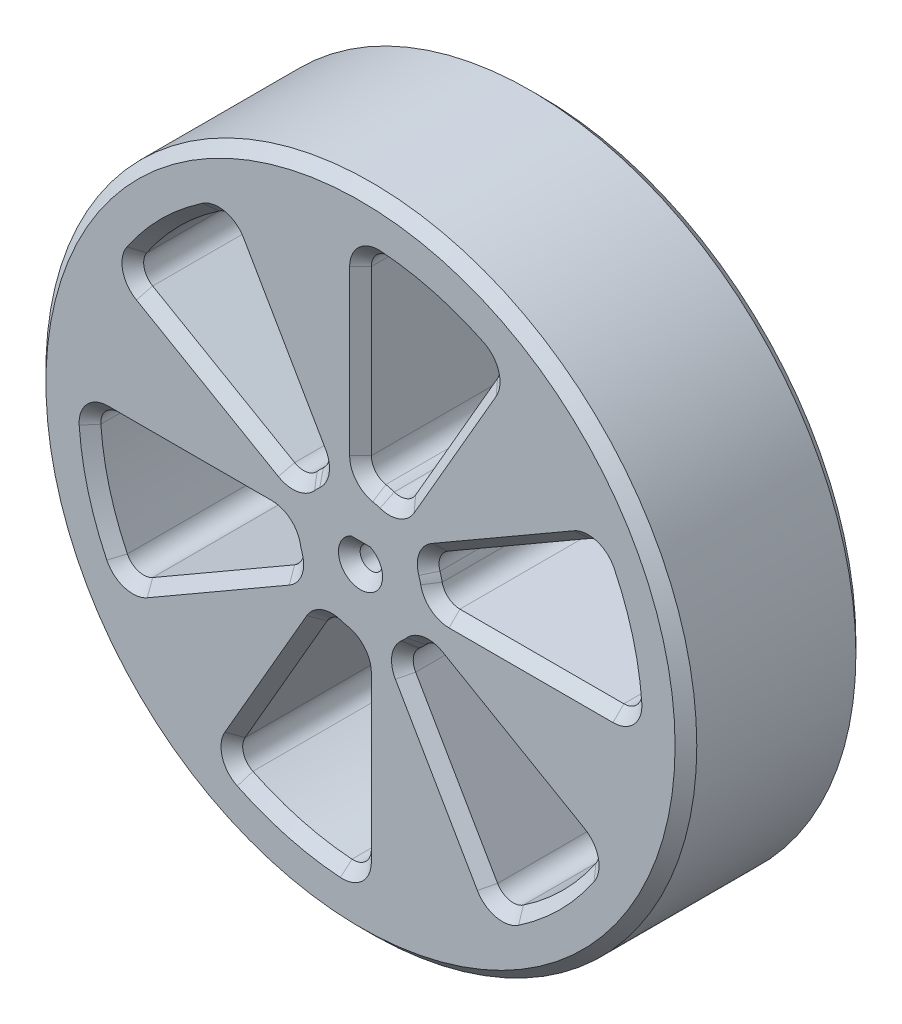
from build123d import *

# Parameters (mm, degrees)
SKETCH1_R           = 90
BOSS_EXTRUDE1_DEPTH = 50
CUT_EXTRUDE1_DEPTH  = 137.747943312
CIRPATTERN1_COUNT   = 6
FILLET1_R           = 5
CUT_EXTRUDE2_DEPTH  = 137.747943312
CHAMFER1_SIZE       = 3


with BuildPart() as part:
    # Sketch1 → Boss-Extrude1 (new body)
    with BuildSketch(Plane.XY):
        Circle(SKETCH1_R)
    extrude(amount=BOSS_EXTRUDE1_DEPTH)

    # Sketch2 → Cut-Extrude1 (cut, through all)
    with BuildSketch(Plane.XY.offset(50)):
        with BuildLine():
            Line((0, 75), (0, 20))
            ThreePointArc((0, 20), (5.176380902, 19.318516526), (10, 17.320508076))
            Line((10, 17.320508076), (37.5, 64.951905284))
            ThreePointArc((37.5, 64.951905284), (19.411428383, 72.444436972), (0, 75))
        make_face()
    cut_extrude1 = extrude(amount=-CUT_EXTRUDE1_DEPTH, mode=Mode.SUBTRACT)

    # CirPattern1: Cut-Extrude1 ×6 about axis
    cirpattern1_axis = Axis((0, 0, 50), (0, 0, -1))
    for i in range(1, CIRPATTERN1_COUNT):
        add(cut_extrude1.rotate(cirpattern1_axis, i * 360 / CIRPATTERN1_COUNT), mode=Mode.SUBTRACT)

    # Fillet1
    fillet1_edges = [part.edges().sort_by_distance(p)[0] for p in [
        (0, 75, 25),
        (37.5, 64.951905284, 25),
        (10, 17.320508076, 25),
        (-17.320508076, 10, 25),
        (-64.951905284, 37.5, 25),
        (-37.5, 64.951905284, 25),
        (-10, 17.320508076, 25),
        (0, -20, 25),
        (0, -75, 25),
        (-37.5, -64.951905284, 25),
        (-10, -17.320508076, 25),
        (-17.320508076, -10, 25),
        (-64.951905284, -37.5, 25),
        (-75, 0, 25),
        (-20, 0, 25),
        (17.320508076, -10, 25),
        (64.951905284, -37.5, 25),
        (37.5, -64.951905284, 25),
        (10, -17.320508076, 25),
        (17.320508076, 10, 25),
        (64.951905284, 37.5, 25),
        (75, 0, 25),
        (20, 0, 25),
        (0, 20, 25),
    ]]
    fillet(fillet1_edges, radius=FILLET1_R)

    # Sketch3 → Cut-Extrude2 (cut, through all)
    with BuildSketch(Plane.XY.offset(50)):
        with BuildLine():
            Line((1.833030278, 2.5), (-1.833030278, 2.5))
            ThreePointArc((-1.833030278, 2.5), (-1.401357581, -2.76517575), (3.1, 0))
            ThreePointArc((3.1, 0), (2.76517575, 1.401357581), (1.833030278, 2.5))
        make_face()
    extrude(amount=-CUT_EXTRUDE2_DEPTH, mode=Mode.SUBTRACT)

    # Chamfer1
    chamfer1_edges = [part.edges().sort_by_distance(p)[0] for p in [
        (-90, 0, 50),
        (35.360769949, 64.432798708, 50),
        (19.411428383, 72.444436972, 50),
        (1.593074281, 73.480825492, 50),
        (0, 47.158048823, 50),
        (1.127016654, 21.332619768, 50),
        (5.176380902, 19.318516526, 50),
        (9.690284831, 19.038098975, 50),
        (23.579024412, 40.840068274, 50),
        (-38.120055543, 62.839724427, 50),
        (-53.033008589, 53.033008589, 50),
        (-62.839724427, 38.120055543, 50),
        (-40.840068274, 23.579024412, 50),
        (-17.911082321, 11.642334937, 50),
        (-14.142135624, 14.142135624, 50),
        (-11.642334937, 17.911082321, 50),
        (-23.579024412, 40.840068274, 50),
        (-35.360769949, -64.432798708, 50),
        (-19.411428383, -72.444436972, 50),
        (-1.593074281, -73.480825492, 50),
        (0, -47.158048823, 50),
        (-1.127016654, -21.332619768, 50),
        (-5.176380902, -19.318516526, 50),
        (-9.690284831, -19.038098975, 50),
        (-23.579024412, -40.840068274, 50),
        (-73.480825492, -1.593074281, 50),
        (-72.444436972, -19.411428383, 50),
        (-64.432798708, -35.360769949, 50),
        (-40.840068274, -23.579024412, 50),
        (-19.038098975, -9.690284831, 50),
        (-19.318516526, -5.176380902, 50),
        (-21.332619768, -1.127016654, 50),
        (-47.158048823, 0, 50),
        (38.120055543, -62.839724427, 50),
        (53.033008589, -53.033008589, 50),
        (62.839724427, -38.120055543, 50),
        (40.840068274, -23.579024412, 50),
        (17.911082321, -11.642334937, 50),
        (14.142135624, -14.142135624, 50),
        (11.642334937, -17.911082321, 50),
        (23.579024412, -40.840068274, 50),
        (73.480825492, 1.593074281, 50),
        (72.444436972, 19.411428383, 50),
        (64.432798708, 35.360769949, 50),
        (40.840068274, 23.579024412, 50),
        (19.038098975, 9.690284831, 50),
        (19.318516526, 5.176380902, 50),
        (21.332619768, 1.127016654, 50),
        (47.158048823, 0, 50),
        (0, 2.5, 50),
        (0, -3.1, 50),
        (-90, 0, 0),
        (1.127016654, 21.332619768, 0),
        (0, 47.158048823, 0),
        (1.593074281, 73.480825492, 0),
        (19.411428383, 72.444436972, 0),
        (35.360769949, 64.432798708, 0),
        (23.579024412, 40.840068274, 0),
        (9.690284831, 19.038098975, 0),
        (5.176380902, 19.318516526, 0),
        (-17.911082321, 11.642334937, 0),
        (-40.840068274, 23.579024412, 0),
        (-62.839724427, 38.120055543, 0),
        (-53.033008589, 53.033008589, 0),
        (-38.120055543, 62.839724427, 0),
        (-23.579024412, 40.840068274, 0),
        (-11.642334937, 17.911082321, 0),
        (-14.142135624, 14.142135624, 0),
        (-1.127016654, -21.332619768, 0),
        (0, -47.158048823, 0),
        (-1.593074281, -73.480825492, 0),
        (-19.411428383, -72.444436972, 0),
        (-35.360769949, -64.432798708, 0),
        (-23.579024412, -40.840068274, 0),
        (-9.690284831, -19.038098975, 0),
        (-5.176380902, -19.318516526, 0),
        (-19.038098975, -9.690284831, 0),
        (-40.840068274, -23.579024412, 0),
        (-64.432798708, -35.360769949, 0),
        (-72.444436972, -19.411428383, 0),
        (-73.480825492, -1.593074281, 0),
        (-47.158048823, 0, 0),
        (-21.332619768, -1.127016654, 0),
        (-19.318516526, -5.176380902, 0),
        (17.911082321, -11.642334937, 0),
        (40.840068274, -23.579024412, 0),
        (62.839724427, -38.120055543, 0),
        (53.033008589, -53.033008589, 0),
        (38.120055543, -62.839724427, 0),
        (23.579024412, -40.840068274, 0),
        (11.642334937, -17.911082321, 0),
        (14.142135624, -14.142135624, 0),
        (19.038098975, 9.690284831, 0),
        (40.840068274, 23.579024412, 0),
        (64.432798708, 35.360769949, 0),
        (72.444436972, 19.411428383, 0),
        (73.480825492, 1.593074281, 0),
        (47.158048823, 0, 0),
        (21.332619768, 1.127016654, 0),
        (19.318516526, 5.176380902, 0),
        (0, -3.1, 0),
        (0, 2.5, 0),
    ]]
    chamfer(chamfer1_edges, length=CHAMFER1_SIZE)


solid = part.part
